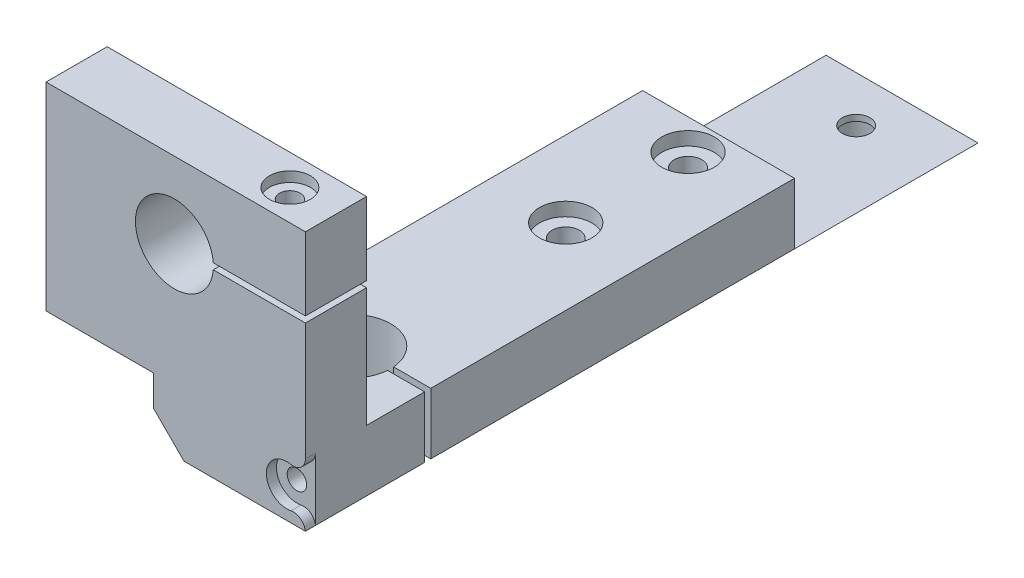
from build123d import *

# Parameters (mm, degrees)
SKETCH1_W                       = 24.85
SKETCH1_H                       = 110
BOSS_EXTRUDE1_DEPTH             = 15
SKETCH2_W                       = 24.85
SKETCH2_H                       = 30
CUT_EXTRUDE1_DEPTH              = 10
SKETCH4_W                       = 35
SKETCH4_H                       = 5
CUT_EXTRUDE3_DEPTH              = 63.189408262
SKETCH5_W                       = 17.575
SKETCH5_H                       = 10
BOSS_EXTRUDE2_DEPTH             = 10
SKETCH6_W                       = 42.425
SKETCH6_H                       = 10
BOSS_EXTRUDE3_DEPTH             = 32.42
CHAMFER2_SIZE                   = 5
SKETCH7_R                       = 6.375
CUT_EXTRUDE4_DEPTH              = 71.541168122
SKETCH8_R                       = 6.375
CUT_EXTRUDE5_DEPTH              = 115.667590888
CBORE_FOR_M4_SHCS1_D            = 4.5
CBORE_FOR_M4_SHCS1_DEPTH        = 10.1
CBORE_FOR_M4_SHCS1_CBORE_D      = 8
CBORE_FOR_M4_SHCS1_CBORE_DEPTH  = 4
CBORE_FOR_M4_SHCS1_TIP          = 1.351936393
M4X0_7_TAPPED_HOLE1_D           = 3.3
SKETCH15_W                      = 17.575
SKETCH15_H                      = 10
CUT_EXTRUDE6_DEPTH              = 115.667590888
CHAMFER6_SIZE                   = 5
SKETCH16_W                      = 15
SKETCH16_H                      = 1
CUT_EXTRUDE7_DEPTH              = 71.541168122
CBORE_FOR_M3_SBHCS1_D           = 3.2
CBORE_FOR_M3_SBHCS1_DEPTH       = 19.5
CBORE_FOR_M3_SBHCS1_CBORE_D     = 6.7
CBORE_FOR_M3_SBHCS1_CBORE_DEPTH = 1.65
M3X0_5_TAPPED_HOLE1_D           = 2.5
M3X0_5_TAPPED_HOLE1_DEPTH       = 7.5
M3X0_5_TAPPED_HOLE1_TIP         = 0.751075774
CUT_EXTRUDE8_REACH              = 125.485
SKETCH24_W                      = 22
SKETCH24_H                      = 1
CBORE_FOR_M3_SBHCS2_D           = 3.4
CBORE_FOR_M3_SBHCS2_DEPTH       = 11.92
CBORE_FOR_M3_SBHCS2_CBORE_D     = 6.7
CBORE_FOR_M3_SBHCS2_CBORE_DEPTH = 1.65
M3X0_5_TAPPED_HOLE2_D           = 2.5
M3X0_5_TAPPED_HOLE2_DEPTH       = 7.5
M3X0_5_TAPPED_HOLE2_TIP         = 0.751075774
M4X0_7_TAPPED_HOLE2_D           = 3.3
M4X0_7_TAPPED_HOLE2_DEPTH       = 10.1
M4X0_7_TAPPED_HOLE2_TIP         = 0.991420021
CBORE_FOR_M4_SBHCS1_D           = 4.5
CBORE_FOR_M4_SBHCS1_CBORE_D     = 8.6
CBORE_FOR_M4_SBHCS1_CBORE_DEPTH = 2.2
FILLET2_R                       = 2


with BuildPart() as part:
    # Sketch1 → Boss-Extrude1 (new body)
    with BuildSketch(Plane(origin=(0, 0, 0), x_dir=(1, 0, 0), z_dir=(0, 1, 0))):
        Rectangle(SKETCH1_W, SKETCH1_H)
    extrude(amount=BOSS_EXTRUDE1_DEPTH)

    # Sketch2 → Cut-Extrude1 (cut)
    with BuildSketch(Plane(origin=(0, 15, 0), x_dir=(1, 0, 0), z_dir=(0, 1, 0))):
        with Locations((0, 40)):
            Rectangle(SKETCH2_W, SKETCH2_H)
    extrude(amount=-CUT_EXTRUDE1_DEPTH, mode=Mode.SUBTRACT)

    # Sketch4 → Cut-Extrude3 (cut, through all)
    with BuildSketch(Plane.ZY.offset(12.425)):
        with Locations((37.5, 2.5)):
            Rectangle(SKETCH4_W, SKETCH4_H)
    extrude(amount=-CUT_EXTRUDE3_DEPTH, mode=Mode.SUBTRACT)

    # Sketch5 → Boss-Extrude2 (add)
    with BuildSketch(Plane(origin=(0, 15, 0), x_dir=(1, 0, 0), z_dir=(0, 1, 0))):
        with Locations((-21.2125, -50)):
            Rectangle(SKETCH5_W, SKETCH5_H)
    extrude(amount=-BOSS_EXTRUDE2_DEPTH)

    # Sketch6 → Boss-Extrude3 (add)
    with BuildSketch(Plane(origin=(0, 15, 0), x_dir=(1, 0, 0), z_dir=(0, 1, 0))):
        with Locations((-8.7875, -50)):
            Rectangle(SKETCH6_W, SKETCH6_H)
    extrude(amount=BOSS_EXTRUDE3_DEPTH)

    # Chamfer2
    chamfer2_edges = [part.edges().sort_by_distance(p)[0] for p in [
        (12.425, 0, -17.5),
        (-12.425, 0, -17.5),
    ]]
    chamfer(chamfer2_edges, length=CHAMFER2_SIZE)

    # Sketch7 → Cut-Extrude4 (cut, through all)
    with BuildSketch(Plane(origin=(0, 15, 0), x_dir=(1, 0, 0), z_dir=(0, 1, 0))):
        with Locations(Location((0, -35, 0), (0, 0, 270))):
            Circle(SKETCH7_R)
    extrude(amount=-CUT_EXTRUDE4_DEPTH, mode=Mode.SUBTRACT)

    # Sketch8 → Cut-Extrude5 (cut, through all)
    with BuildSketch(Plane(origin=(0, 0, 45), x_dir=(-1, 0, 0), z_dir=(0, 0, -1))):
        with Locations((9, 35)):
            Circle(SKETCH8_R)
    extrude(amount=-CUT_EXTRUDE5_DEPTH, mode=Mode.SUBTRACT)

    # CBORE for M4 SHCS1
    with Locations(Plane(origin=(0, 0, 0), x_dir=(-1, 0, 0), z_dir=(0, -1, 0))):
        with Locations((0, 47.5), (0, 32.5)):
            CounterBoreHole(CBORE_FOR_M4_SHCS1_D / 2, CBORE_FOR_M4_SHCS1_CBORE_D / 2, CBORE_FOR_M4_SHCS1_CBORE_DEPTH, depth=CBORE_FOR_M4_SHCS1_DEPTH)
            with Locations((0, 0, -(CBORE_FOR_M4_SHCS1_DEPTH + CBORE_FOR_M4_SHCS1_TIP / 2))):  # 118° drill point
                Cone(0, CBORE_FOR_M4_SHCS1_D / 2, CBORE_FOR_M4_SHCS1_TIP, mode=Mode.SUBTRACT)

    # M4x0.7 Tapped Hole1 (through all)
    with Locations(Plane(origin=(0, 0, 0), x_dir=(-1, 0, 0), z_dir=(0, -1, 0))):
        with Locations((0, 20), (0, 0)):
            Hole(M4X0_7_TAPPED_HOLE1_D / 2)

    # Sketch15 → Cut-Extrude6 (cut, through all)
    with BuildSketch(Plane(origin=(0, 0, 45), x_dir=(-1, 0, 0), z_dir=(0, 0, -1))):
        with Locations((21.2125, 10)):
            Rectangle(SKETCH15_W, SKETCH15_H)
    extrude(amount=-CUT_EXTRUDE6_DEPTH, mode=Mode.SUBTRACT)

    # Chamfer6
    chamfer6_edges = [part.edges().sort_by_distance(p)[0] for p in [
        (-12.425, 5, 37.5),
    ]]
    chamfer(chamfer6_edges, length=CHAMFER6_SIZE)

    # Sketch16 → Cut-Extrude7 (cut, through all)
    with BuildSketch(Plane(origin=(0, 15, 0), x_dir=(1, 0, 0), z_dir=(0, 1, 0))):
        with Locations((12.425, -35)):
            Rectangle(SKETCH16_W, SKETCH16_H)
    extrude(amount=-CUT_EXTRUDE7_DEPTH, mode=Mode.SUBTRACT)

    # CBORE for M3 SBHCS1
    with Locations(Plane(origin=(9.390180955, 10, 55), x_dir=(1, 0, 0), z_dir=(0, 0, 1))):
        with Locations((0, 0)):
            CounterBoreHole(CBORE_FOR_M3_SBHCS1_D / 2, CBORE_FOR_M3_SBHCS1_CBORE_D / 2, CBORE_FOR_M3_SBHCS1_CBORE_DEPTH, depth=CBORE_FOR_M3_SBHCS1_DEPTH)

    # M3x0.5 Tapped Hole1
    with Locations(Plane.XY.offset(34.5)):
        with Locations((9.390180955, 10)):
            Hole(M3X0_5_TAPPED_HOLE1_D / 2, depth=M3X0_5_TAPPED_HOLE1_DEPTH)
            with Locations((0, 0, -(M3X0_5_TAPPED_HOLE1_DEPTH + M3X0_5_TAPPED_HOLE1_TIP / 2))):  # 118° drill point
                Cone(0, M3X0_5_TAPPED_HOLE1_D / 2, M3X0_5_TAPPED_HOLE1_TIP, mode=Mode.SUBTRACT)

    # Sketch24 → Cut-Extrude8 (cut, up to next)
    with BuildSketch(Plane.XY.offset(55), mode=Mode.PRIVATE) as cut_extrude8_sk1:
        with Locations((1.425, 35)):
            Rectangle(SKETCH24_W, SKETCH24_H)
    cut_extrude8_tool1 = extrude(cut_extrude8_sk1.sketch, amount=-CUT_EXTRUDE8_REACH, mode=Mode.PRIVATE) & part.part
    add(cut_extrude8_tool1.solids().sort_by_distance((1.425, 35, 55))[0], mode=Mode.SUBTRACT)

    # CBORE for M3 SBHCS2
    with Locations(Plane(origin=(0, 47.42, 0), x_dir=(1, 0, 0), z_dir=(0, 1, 0))):
        with Locations((4.890180955, -50)):
            CounterBoreHole(CBORE_FOR_M3_SBHCS2_D / 2, CBORE_FOR_M3_SBHCS2_CBORE_D / 2, CBORE_FOR_M3_SBHCS2_CBORE_DEPTH, depth=CBORE_FOR_M3_SBHCS2_DEPTH)

    # M3x0.5 Tapped Hole2
    with Locations(Plane(origin=(0, 34.5, 0), x_dir=(1, 0, 0), z_dir=(0, 1, 0))):
        with Locations((4.890180955, -50)):
            Hole(M3X0_5_TAPPED_HOLE2_D / 2, depth=M3X0_5_TAPPED_HOLE2_DEPTH)
            with Locations((0, 0, -(M3X0_5_TAPPED_HOLE2_DEPTH + M3X0_5_TAPPED_HOLE2_TIP / 2))):  # 118° drill point
                Cone(0, M3X0_5_TAPPED_HOLE2_D / 2, M3X0_5_TAPPED_HOLE2_TIP, mode=Mode.SUBTRACT)

    # M4x0.7 Tapped Hole2
    with Locations(Plane.ZY.offset(30)):
        with Locations((50, 35)):
            Hole(M4X0_7_TAPPED_HOLE2_D / 2, depth=M4X0_7_TAPPED_HOLE2_DEPTH)
            with Locations((0, 0, -(M4X0_7_TAPPED_HOLE2_DEPTH + M4X0_7_TAPPED_HOLE2_TIP / 2))):  # 118° drill point
                Cone(0, M4X0_7_TAPPED_HOLE2_D / 2, M4X0_7_TAPPED_HOLE2_TIP, mode=Mode.SUBTRACT)

    # CBORE for M4 SBHCS1 (through all)
    with Locations(Plane(origin=(0, 15, 0), x_dir=(1, 0, 0), z_dir=(0, 1, 0))):
        with Locations((0, 20), (0, 0)):
            CounterBoreHole(CBORE_FOR_M4_SBHCS1_D / 2, CBORE_FOR_M4_SBHCS1_CBORE_D / 2, CBORE_FOR_M4_SBHCS1_CBORE_DEPTH)

    # Fillet2
    # the kernel refuses this fillet: 2 mm, written as the material it takes off along each edge
    with BuildSketch(Plane(origin=(12.425, 11.418581462, 53.35), x_dir=(0, 1, 0), z_dir=(0, 0, 1))) as fillet2_piece_1:
        with BuildLine():
            CenterArc((3.83038506, 2), FILLET2_R, 168.847320213, 101.152679787)
            Line((1.868154584, 2.386848241), (1.828909975, 2.394585206))
            ThreePointArc((1.828909975, 2.394585206), (1.187961295, 0.994712466), (-0.016938286, 0.036236645))
            Line((-0.016938286, 0.036236645), (0, -0.04))
            Line((0, -0.04), (3.83038506, -0.04))
            Line((3.83038506, -0.04), (3.83038506, 0))
        make_face()
    extrude(amount=11.225962649, mode=Mode.SUBTRACT)
    with BuildSketch(Plane(origin=(12.425, 8.581418538, 53.35), x_dir=(0, -1, 0), z_dir=(0, 0, 1))) as fillet2_piece_2:
        with BuildLine():
            CenterArc((3.827369434, -1.984819427), FILLET2_R, 97.063855439, 94.254577376)
            Line((1.866266295, -2.377342649), (1.827044233, -2.385193113))
            ThreePointArc((1.827044233, -2.385193113), (1.18500762, -0.99094432), (-0.016938286, -0.036236645))
            Line((-0.016938286, -0.036236645), (0, 0.04))
            ThreePointArc((0, 0.04), (1.790709269, 0.04), (3.57649952, 0.039696389))
            Line((3.57649952, 0.039696389), (3.581418538, 0))
        make_face()
    extrude(amount=10.603546345, mode=Mode.SUBTRACT)


solid = part.part
